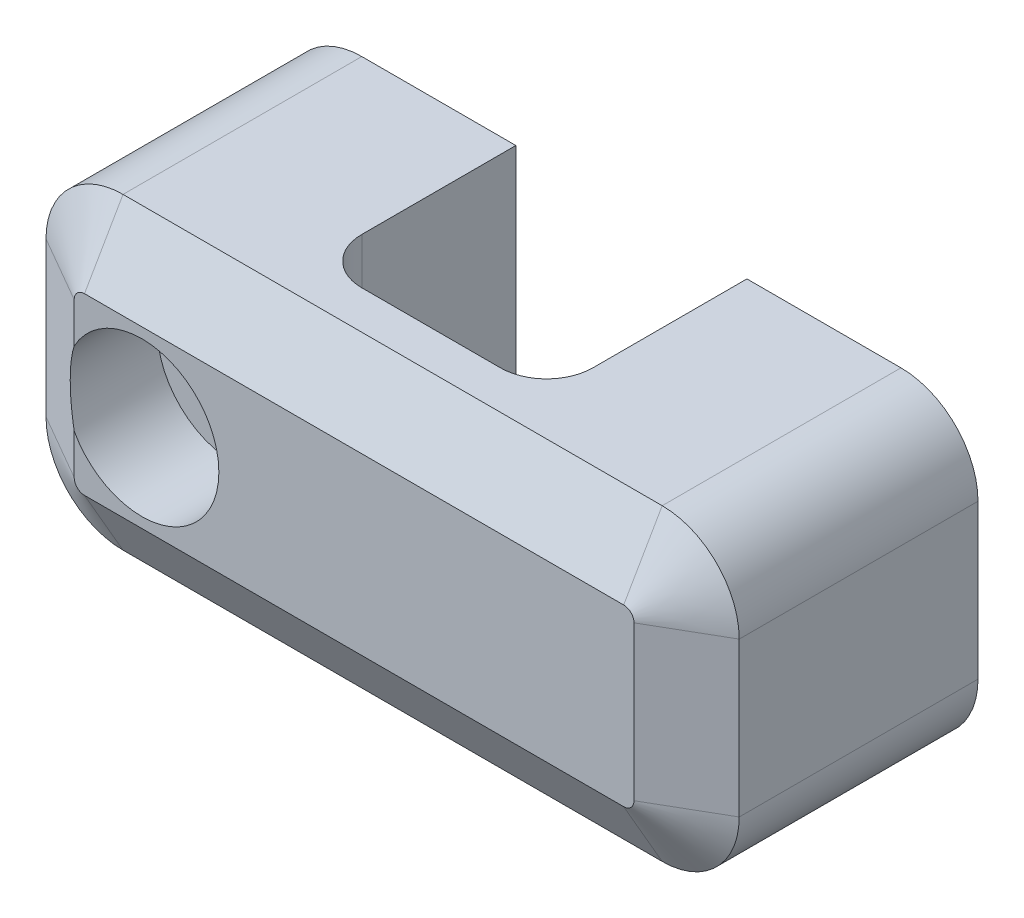
from build123d import *

# Parameters (mm, degrees)
SKETCH1_W       = 45
SKETCH1_H       = 20
EXTRUDE1_DEPTH  = 5
SKETCH2_W       = 15
SKETCH2_H       = 20
EXTRUDE2_DEPTH  = 13
SKETCH3_R       = 5
EXTRUDE3_DEPTH  = 6
SKETCH4_R       = 2.5
EXTRUDE4_DEPTH  = 16
FILLET1_R       = 5
CHAMFER1_SIZE   = 4.330127019
CHAMFER1_SIZE_2 = 2.5
FILLET2_R       = 3
FILLET3_R       = 3


with BuildPart() as part:
    # Sketch1 → Extrude1 (new body)
    with BuildSketch(Plane.XY):
        Rectangle(SKETCH1_W, SKETCH1_H)
    extrude(amount=EXTRUDE1_DEPTH)

    # Sketch2 → Extrude2 (add)
    with BuildSketch(Plane(origin=(0, 0, 0), x_dir=(-1, 0, 0), z_dir=(0, 0, -1))):
        with Locations((15, 0)):
            Rectangle(SKETCH2_W, SKETCH2_H)
        with Locations((-15, 0)):
            Rectangle(SKETCH2_W, SKETCH2_H)
    extrude(amount=EXTRUDE2_DEPTH)

    # Sketch3 → Extrude3 (cut)
    with BuildSketch(Plane.XY.offset(5)):
        with Locations((-13.77840955, 0)):
            Circle(SKETCH3_R)
    extrude(amount=-EXTRUDE3_DEPTH, mode=Mode.SUBTRACT)

    # Sketch4 → Extrude4 (cut)
    with BuildSketch(Plane.XY.offset(-1)):
        with Locations((-13.77840955, 0)):
            Circle(SKETCH4_R)
    extrude(amount=-EXTRUDE4_DEPTH, mode=Mode.SUBTRACT)

    # Fillet1
    fillet1_edges = [part.edges().sort_by_distance(p)[0] for p in [
        (-22.5, 10, -4),
        (22.5, 10, -4),
        (22.5, -10, -4),
        (-22.5, -10, -4),
    ]]
    fillet(fillet1_edges, radius=FILLET1_R)

    # Chamfer1
    # the kernel refuses this chamfer: 4.330127019, 2.5 mm, written as the material it takes off along each edge
    with BuildSketch(Plane(origin=(22.5, 5, 5), x_dir=(-0.999813220622208, 0, 0.01932676561270069), z_dir=(0, -1, 0)), Plane(origin=(-22.5, -5, 5), x_dir=(0.999813220622208, 0, 0.01932676561270069), z_dir=(0, 1, 0))) as chamfer1_piece_1:
        Polygon((CHAMFER1_SIZE * 0.999813220604, CHAMFER1_SIZE * 0.0193267656124), (-CHAMFER1_SIZE_2 * 0.0193267656127, CHAMFER1_SIZE_2 * 0.999813220622), (0, 0), align=None)
    extrude(amount=10, mode=Mode.SUBTRACT)
    with BuildSketch(Plane(origin=(17.5, -10, 5), x_dir=(0, -0.05789386240267114, -0.9983227437537926), z_dir=(-1, 0, 0))) as chamfer1_piece_2:
        Polygon((CHAMFER1_SIZE_2 * 0.998322743754, -CHAMFER1_SIZE_2 * 0.0578938624027), (-CHAMFER1_SIZE * 0.0578938624016, -CHAMFER1_SIZE * 0.998322743736), (0, 0), align=None)
    extrude(amount=35, mode=Mode.SUBTRACT)
    with BuildSketch(Plane(origin=(-17.5, 10, 5), x_dir=(0, -0.999813220622208, 0.01932676561270069), z_dir=(1, 0, 0))) as chamfer1_piece_3:
        Polygon((CHAMFER1_SIZE * 0.999813220604, CHAMFER1_SIZE * 0.0193267656124), (-CHAMFER1_SIZE_2 * 0.0193267656127, CHAMFER1_SIZE_2 * 0.999813220622), (0, 0), align=None)
    extrude(amount=35, mode=Mode.SUBTRACT)
    with BuildSketch(Plane(origin=(-17.5, 5, 5), x_dir=(-1, 0, 0), z_dir=(0, -1, 0))) as chamfer1_piece_4:
        Polygon((5 - CHAMFER1_SIZE, 0), (5, CHAMFER1_SIZE_2), (5, 0), align=None)
    revolve(axis=Axis((-17.5, 5, 5), (0, 0, -1)), revolution_arc=90, mode=Mode.SUBTRACT)
    with BuildSketch(Plane(origin=(-17.5, -5, 5), x_dir=(0, -1, 0), z_dir=(1, 0, 0))) as chamfer1_piece_5:
        Polygon((5 - CHAMFER1_SIZE, 0), (5, CHAMFER1_SIZE_2), (5, 0), align=None)
    revolve(axis=Axis((-17.5, -5, 5), (0, 0, -1)), revolution_arc=90, mode=Mode.SUBTRACT)
    with BuildSketch(Plane(origin=(17.5, 5, 5), x_dir=(1, 0, 0), z_dir=(0, -1, 0))) as chamfer1_piece_6:
        Polygon((5 - CHAMFER1_SIZE, 0), (5, -CHAMFER1_SIZE_2), (5, 0), align=None)
    revolve(axis=Axis((17.5, 5, 5), (0, 0, 1)), revolution_arc=90, mode=Mode.SUBTRACT)
    with BuildSketch(Plane(origin=(17.5, -5, 5), x_dir=(0, -1, 0), z_dir=(-1, 0, 0))) as chamfer1_piece_7:
        Polygon((5 - CHAMFER1_SIZE, 0), (5, -CHAMFER1_SIZE_2), (5, 0), align=None)
    revolve(axis=Axis((17.5, -5, 5), (0, 0, 1)), revolution_arc=90, mode=Mode.SUBTRACT)

    # Fillet2
    fillet2_edges = [part.edges().sort_by_distance(p)[0] for p in [
        (-7.5, 0, 0),
    ]]
    fillet(fillet2_edges, radius=FILLET2_R)

    # Fillet3
    fillet3_edges = [part.edges().sort_by_distance(p)[0] for p in [
        (7.5, 0, 0),
    ]]
    fillet(fillet3_edges, radius=FILLET3_R)


solid = part.part
